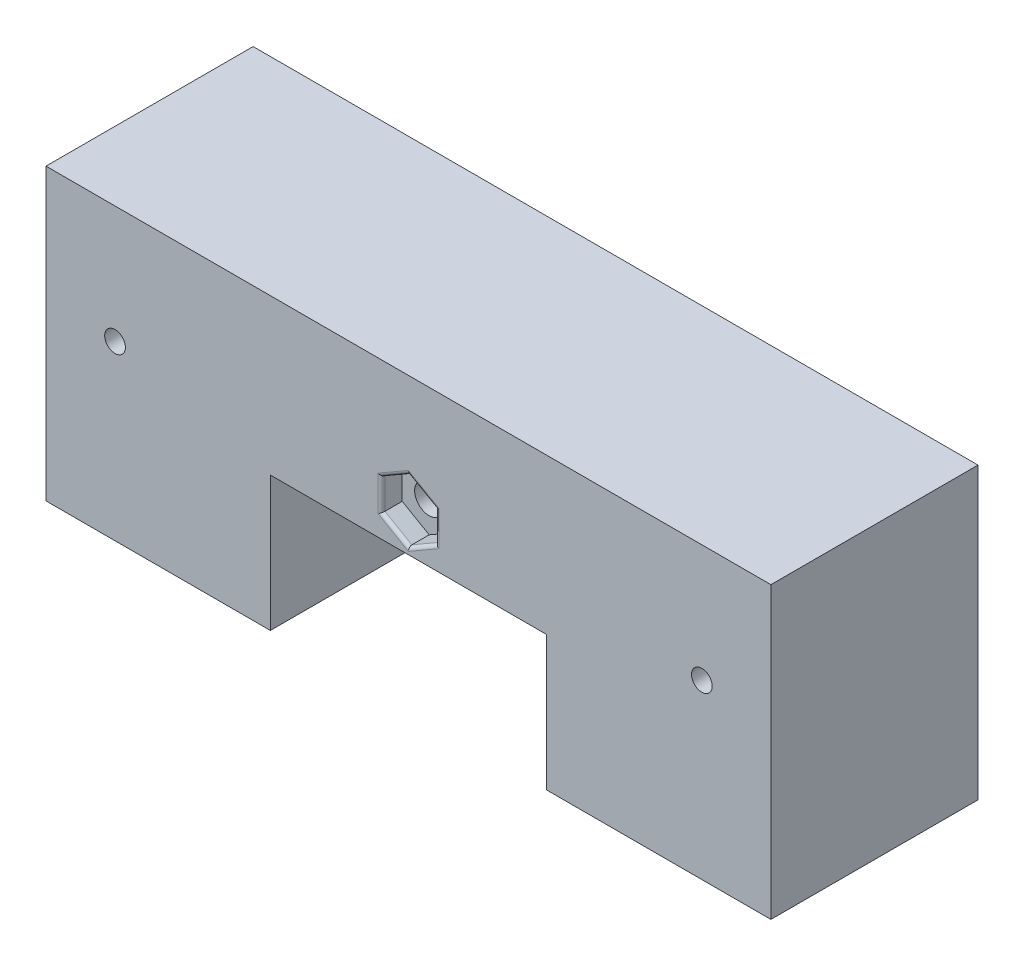
from build123d import *

# Parameters (mm, degrees)
ESQUISSE1_W              = 105
ESQUISSE1_H              = 42
BOSS_EXTRU_1_DEPTH       = 30
ENL_V_MAT_EXTRU_1_DEPTH  = 3
CONG_2_R                 = 0.5
ESQUISSE8_R              = 2.103774153
ENL_V_MAT_EXTRU_3_DEPTH  = 118
ESQUISSE10_W             = 20
ESQUISSE10_H             = 5
ESQUISSE10_W_2           = 5
ESQUISSE10_H_2           = 15
ENL_V_MAT_EXTRU_6_DEPTH  = 8
ESQUISSE3_R              = 1.5
ENL_V_MAT_EXTRU_7_DEPTH  = 118
ESQUISSE14_R             = 1.5
ENL_V_MAT_EXTRU_10_DEPTH = 30
ESQUISSE15_W             = 40
ESQUISSE15_H             = 19.5
ENL_V_MAT_EXTRU_11_DEPTH = 20


with BuildPart() as part:
    # Esquisse1 → Boss.-Extru.1 (new body)
    with BuildSketch(Plane.XY):
        with Locations((-52.5, 21)):
            Rectangle(ESQUISSE1_W, ESQUISSE1_H)
    extrude(amount=BOSS_EXTRU_1_DEPTH)

    # Esquisse2 → Enlèv. mat.-Extru.1 (cut)
    with BuildSketch(Plane.XY.offset(30)):
        Polygon((-52.5, 20.4966679), (-48.6, 22.74833395), (-48.6, 27.25166605), (-52.5, 29.5033321), (-56.4, 27.25166605), (-56.4, 22.74833395), align=None)
    extrude(amount=-ENL_V_MAT_EXTRU_1_DEPTH, mode=Mode.SUBTRACT)

    # Congé2
    cong_2_edges = [part.edges().sort_by_distance(p)[0] for p in [
        (-56.4, 25, 30),
        (-54.45, 21.622500925, 30),
        (-50.55, 21.622500925, 30),
        (-48.6, 25, 30),
        (-50.55, 28.377499075, 30),
        (-54.45, 28.377499075, 30),
    ]]
    fillet(cong_2_edges, radius=CONG_2_R)

    # Esquisse8 → Enlèv. mat.-Extru.3 (cut, through all)
    with BuildSketch(Plane.XY):
        with Locations((-52.5, 25)):
            Circle(ESQUISSE8_R)
    extrude(amount=ENL_V_MAT_EXTRU_3_DEPTH, mode=Mode.SUBTRACT)

    # Esquisse10 → Enlèv. mat.-Extru.6 (cut)
    with BuildSketch(Plane.XZ):
        with Locations((-15, 7.5)):
            Rectangle(ESQUISSE10_W, ESQUISSE10_H)
        with Locations((-8.89, 20)):
            Rectangle(ESQUISSE10_W_2, ESQUISSE10_H_2)
        with Locations((-96.11, 20)):
            Rectangle(ESQUISSE10_W_2, ESQUISSE10_H_2)
        with Locations((-90, 7.5)):
            Rectangle(ESQUISSE10_W, ESQUISSE10_H)
    extrude(amount=-ENL_V_MAT_EXTRU_6_DEPTH, mode=Mode.SUBTRACT)

    # Esquisse3 → Enlèv. mat.-Extru.7 (cut, through all)
    with BuildSketch(Plane.XY.offset(30)):
        with Locations((-95, 25)):
            Circle(ESQUISSE3_R)
    extrude(amount=-ENL_V_MAT_EXTRU_7_DEPTH, mode=Mode.SUBTRACT)

    # Esquisse14 → Enlèv. mat.-Extru.10 (cut)
    with BuildSketch(Plane.XY.offset(30)):
        with Locations((-10, 25)):
            Circle(ESQUISSE14_R)
    extrude(amount=-ENL_V_MAT_EXTRU_10_DEPTH, mode=Mode.SUBTRACT)

    # Esquisse15 → Enlèv. mat.-Extru.11 (cut)
    with BuildSketch(Plane.XY.offset(30)):
        with Locations((-52.5, 9.75)):
            Rectangle(ESQUISSE15_W, ESQUISSE15_H)
    extrude(amount=-ENL_V_MAT_EXTRU_11_DEPTH, mode=Mode.SUBTRACT)


solid = part.part
